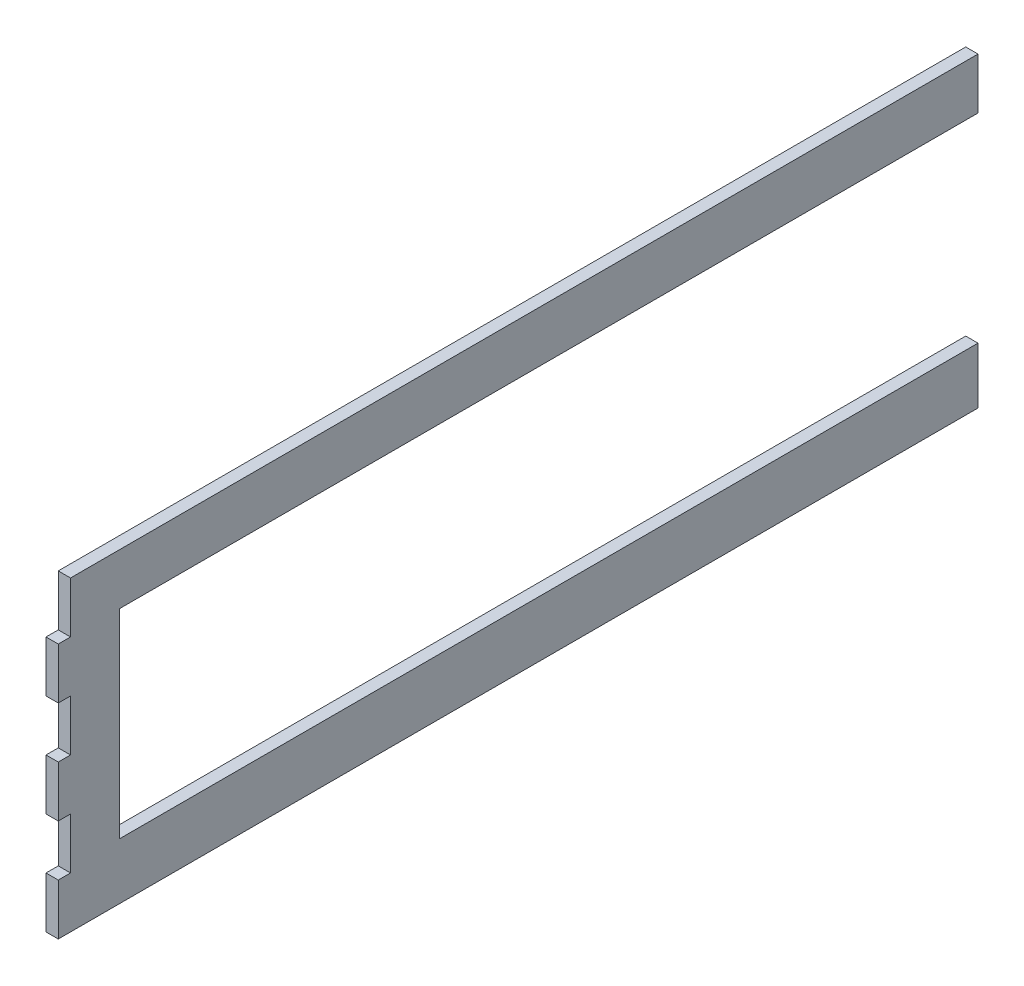
from build123d import *

# Parameters (mm, degrees)
BOSS_EXTRUDE1_DEPTH = 6
SKETCH2_W           = 6
SKETCH2_H           = 25
CUT_EXTRUDE1_DEPTH  = 6
LPATTERN1_COUNT     = 3
LPATTERN1_PITCH     = 50


with BuildPart() as part:
    # Sketch1 → Boss-Extrude1 (new body)
    with BuildSketch(Plane(origin=(0, 0, 0), x_dir=(0, 0, -1), z_dir=(1, 0, 0))):
        Polygon((450, 125), (450, 150), (0, 150), (0, 0), (450, 0), (450, 27.5), (30, 27.5), (30, 125), align=None)
    extrude(amount=BOSS_EXTRUDE1_DEPTH)

    # Sketch2 → Cut-Extrude1 (cut)
    with BuildSketch(Plane(origin=(6, 0, 0), x_dir=(0, 0, -1), z_dir=(1, 0, 0))):
        with Locations((3, 137.5)):
            Rectangle(SKETCH2_W, SKETCH2_H)
    cut_extrude1 = extrude(amount=-CUT_EXTRUDE1_DEPTH, mode=Mode.SUBTRACT)

    # LPattern1: Cut-Extrude1 ×3
    with Locations(*[(0, -i * LPATTERN1_PITCH, 0) for i in range(1, LPATTERN1_COUNT)]):
        add(cut_extrude1, mode=Mode.SUBTRACT)


solid = part.part
